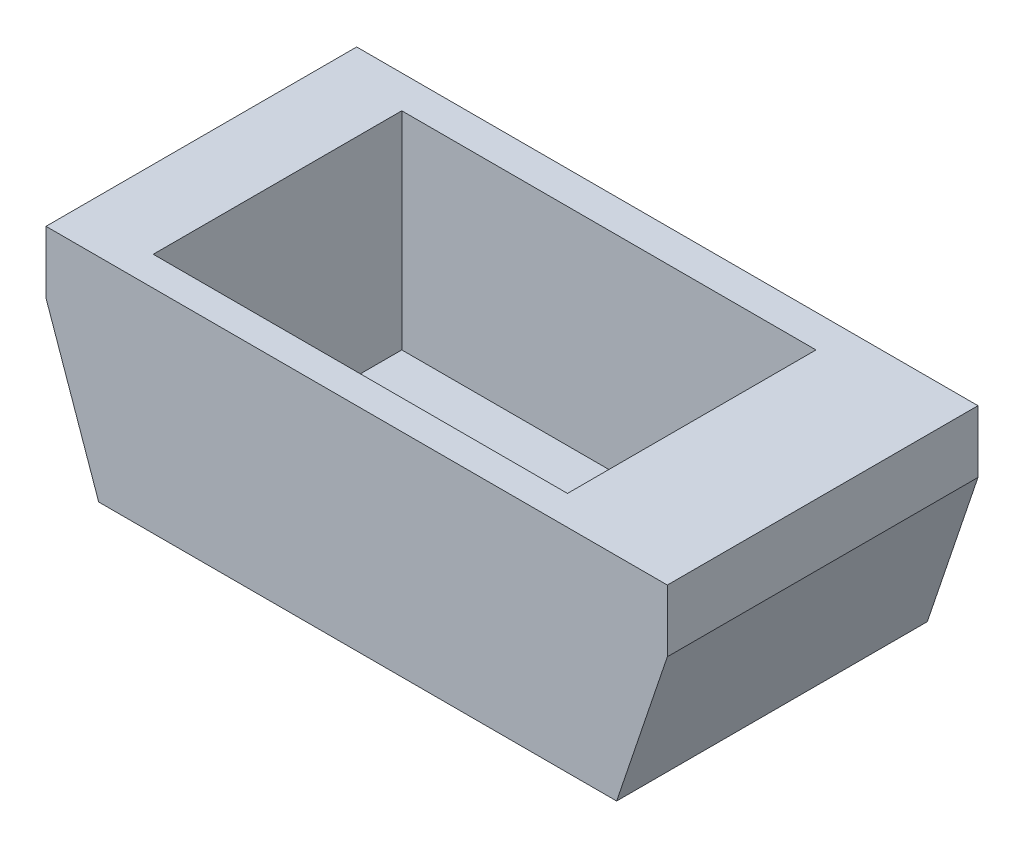
from build123d import *

# Parameters (mm, degrees)
BOSS_EXTRUDE1_DEPTH = 15
SKETCH4_W           = 20
SKETCH4_H           = 12
CUT_EXTRUDE2_DEPTH  = 10


with BuildPart() as part:
    # Sketch1 → Boss-Extrude1 (new body)
    with BuildSketch(Plane.XY):
        Polygon((-49.791399094, 32.645333647), (-19.791399094, 32.645333647), (-19.791399094, 29.645333647), (-22.238991949, 22.388566018), (-47.247714564, 22.388566018), (-49.791399094, 29.645333647), align=None)
    extrude(amount=BOSS_EXTRUDE1_DEPTH)

    # Sketch4 → Cut-Extrude2 (cut)
    with BuildSketch(Plane(origin=(0, 32.645333647, 0), x_dir=(1, 0, 0), z_dir=(0, 1, 0))):
        with Locations((-36.033104466, -7.579842551)):
            Rectangle(SKETCH4_W, SKETCH4_H)
    extrude(amount=-CUT_EXTRUDE2_DEPTH, mode=Mode.SUBTRACT)


solid = part.part
